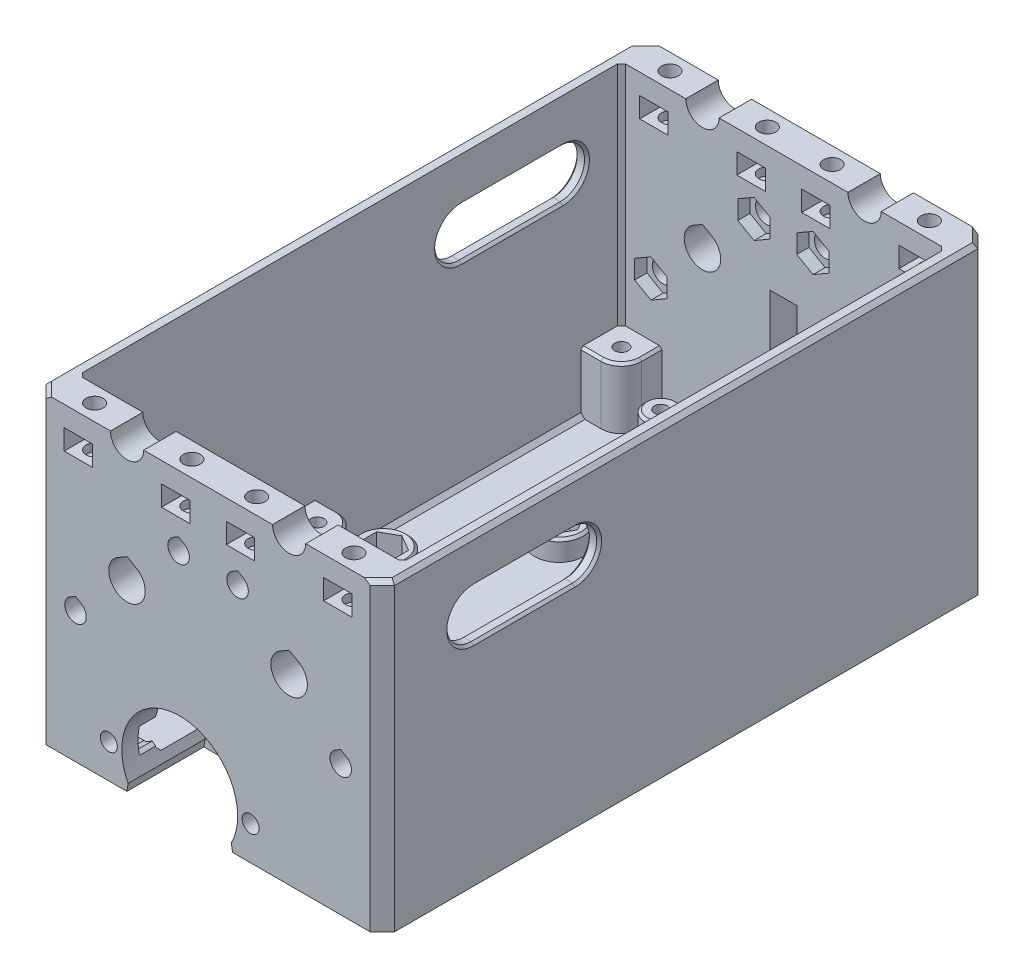
from build123d import *

# Parameters (mm, degrees)
SKETCH1_R                = 4.5
BOSS_EXTRUDE1_DEPTH      = 75
CUT_EXTRUDE1_START       = -4
SKETCH3_W                = 80
SKETCH3_H                = 134
CUT_EXTRUDE1_DEPTH       = 111.450862819
CUT_EXTRUDE2_DEPTH       = 106.233074649
CUT_EXTRUDE2_DEPTH_BACK  = 106.233074649
SKETCH4_R                = 2.65
SKETCH5_R                = 2.1
CUT_EXTRUDE3_DEPTH       = 12
CHAMFER1_SIZE            = 3
CUT_EXTRUDE5_START       = -5
SKETCH7_W                = 7
SKETCH7_H                = 20
CUT_EXTRUDE5_DEPTH       = 5
CUT_EXTRUDE6_DEPTH       = 3
CUT_EXTRUDE7_DEPTH       = 168.179544203
SKETCH11_R               = 2.6
CUT_EXTRUDE9_DEPTH       = 112.870460802
SKETCH14_W               = 3
SKETCH14_H               = 8
CUT_EXTRUDE12_DEPTH      = 112.870460802
FILLET1_R                = 1
CHAMFER2_SIZE            = 1
SKETCH15_R               = 1.6
CUT_EXTRUDE13_DEPTH      = 112.870460802
CUT_EXTRUDE14_DEPTH      = 129.922457314
CUT_EXTRUDE14_DEPTH_BACK = 10
CUT_EXTRUDE15_DEPTH      = 10
CHAMFER3_SIZE            = 1
CHAMFER4_SIZE            = 0.6
BOSS_EXTRUDE2_START      = 8
SKETCH18_R               = 4
SKETCH18_R_2             = 1.6
BOSS_EXTRUDE2_DEPTH      = 8
CHAMFER5_SIZE            = 0.6
SKETCH19_R               = 2.1
CUT_EXTRUDE16_DEPTH      = 19
CUT_EXTRUDE17_DEPTH      = 10
CUT_EXTRUDE17_DEPTH_BACK = 4
CHAMFER6_SIZE            = 0.770830909
CUT_EXTRUDE18_DEPTH      = 3.2
SKETCH22_R               = 6
BOSS_EXTRUDE3_DEPTH      = 5
CHAMFER7_SIZE            = 0.6
CHAMFER8_SIZE            = 1.432680857
CUT_EXTRUDE19_DEPTH      = 127.940931145
SKETCH25_W               = 6.6
SKETCH25_H               = 21
CUT_EXTRUDE20_DEPTH      = 10
SKETCH26_W               = 5
SKETCH26_H               = 21
SKETCH26_R               = 1.15
BOSS_EXTRUDE4_DEPTH      = 3
CHAMFER9_SIZE            = 4
SKETCH27_R               = 1.6
CUT_EXTRUDE21_DEPTH      = 116.282262296
BOSS_EXTRUDE5_START      = 5
SKETCH28_R               = 3.1
SKETCH28_R_2             = 1.6
BOSS_EXTRUDE5_DEPTH      = 5
CHAMFER10_SIZE           = 1.2
CHAMFER11_SIZE           = 0.6
CHAMFER12_SIZE           = 1.2
CUT_EXTRUDE22_DEPTH      = 116.77668159
BOSS_EXTRUDE6_DEPTH      = 3
CHAMFER13_SIZE           = 1.2
SKETCH31_R               = 1.65
CUT_EXTRUDE23_DEPTH      = 109.853112036
BOSS_EXTRUDE7_START      = 15
SKETCH32_R               = 5
SKETCH32_R_2             = 1.65
BOSS_EXTRUDE7_DEPTH      = 15
CUT_EXTRUDE24_START      = -6
CUT_EXTRUDE24_DEPTH      = 101.700515463
CHAMFER14_SIZE           = 0.6
SKETCH34_R               = 3
CUT_EXTRUDE26_DEPTH      = 15
SKETCH35_W               = 4
SKETCH35_H               = 6
CUT_EXTRUDE27_DEPTH      = 9
SKETCH36_W               = 3
SKETCH36_H               = 7
CUT_EXTRUDE28_DEPTH      = 116.282262296
FILLET2_R                = 1
CHAMFER15_SIZE           = 2


with BuildPart() as part:
    # Sketch1 → Boss-Extrude1 (new, symmetric)
    with BuildSketch(Plane.XY):
        with BuildLine():
            Line((-15.9, 15), (15.9, 15))
            ThreePointArc((15.9, 15), (20, 10.9), (24.1, 15))
            Line((24.1, 15), (43, 15))
            Line((43, 15), (43, -60))
            Line((43, -60), (-43, -60))
            Line((-43, -60), (-43, 15))
            Line((-43, 15), (-24.1, 15))
            ThreePointArc((-24.1, 15), (-20, 10.9), (-15.9, 15))
        make_face()
        with Locations((-20, -15)):
            Circle(SKETCH1_R, mode=Mode.SUBTRACT)
        with Locations((20, -15)):
            Circle(SKETCH1_R, mode=Mode.SUBTRACT)
    extrude(amount=BOSS_EXTRUDE1_DEPTH, both=True)

    # Sketch3 → Cut-Extrude1 (cut, through all)
    with BuildSketch(Plane.XZ.offset(60).offset(CUT_EXTRUDE1_START)):
        Rectangle(SKETCH3_W, SKETCH3_H)
    extrude(amount=-CUT_EXTRUDE1_DEPTH, mode=Mode.SUBTRACT)

    # Sketch4 → Cut-Extrude2 (cut, two sides: drawn at the far end of the back side and taken through both)
    with BuildSketch(Plane.XY.offset(-CUT_EXTRUDE2_DEPTH_BACK)):
        with Locations((-7.272077939, -2.272077939)):
            Circle(SKETCH4_R)
        with Locations((7.272077939, -2.272077939)):
            Circle(SKETCH4_R)
        with Locations((32.727922061, -27.727922061)):
            Circle(SKETCH4_R)
        with Locations((-32.727922061, -27.727922061)):
            Circle(SKETCH4_R)
    extrude(amount=CUT_EXTRUDE2_DEPTH + CUT_EXTRUDE2_DEPTH_BACK, mode=Mode.SUBTRACT)

    # Sketch5 → Cut-Extrude3 (cut)
    with BuildSketch(Plane(origin=(0, 15, 0), x_dir=(1, 0, 0), z_dir=(0, 1, 0))):
        with Locations(Location((-32, 71, 0), (0, 0, 180))):
            Circle(SKETCH5_R)
        with Locations(Location((-8, 71, 0), (0, 0, 180))):
            Circle(SKETCH5_R)
        with Locations(Location((8, 71, 0), (0, 0, 180))):
            Circle(SKETCH5_R)
        with Locations(Location((32, 71, 0), (0, 0, 180))):
            Circle(SKETCH5_R)
        with Locations(Location((-32, -71, 0), (0, 0, 180))):
            Circle(SKETCH5_R)
        with Locations(Location((-8, -71, 0), (0, 0, 180))):
            Circle(SKETCH5_R)
        with Locations(Location((8, -71, 0), (0, 0, 180))):
            Circle(SKETCH5_R)
        with Locations(Location((32, -71, 0), (0, 0, 180))):
            Circle(SKETCH5_R)
    extrude(amount=-CUT_EXTRUDE3_DEPTH, mode=Mode.SUBTRACT)

    # Chamfer1
    chamfer1_edges = [part.edges().sort_by_distance(p)[0] for p in [
        (-43, -22.5, -75),
        (-43, -22.5, 75),
        (43, -22.5, 75),
        (43, -22.5, -75),
    ]]
    chamfer(chamfer1_edges, length=CHAMFER1_SIZE)

    # Sketch7 → Cut-Extrude5 (cut)
    with BuildSketch(Plane(origin=(0, 15, 0), x_dir=(1, 0, 0), z_dir=(0, 1, 0)).offset(CUT_EXTRUDE5_START)):
        with Locations((-32, 71)):
            Rectangle(SKETCH7_W, SKETCH7_H)
        with Locations((-8, 71)):
            Rectangle(SKETCH7_W, SKETCH7_H)
        with Locations((8, 71)):
            Rectangle(SKETCH7_W, SKETCH7_H)
        with Locations((32, 71)):
            Rectangle(SKETCH7_W, SKETCH7_H)
        with Locations((-32, -71)):
            Rectangle(SKETCH7_W, SKETCH7_H)
        with Locations((-8, -71)):
            Rectangle(SKETCH7_W, SKETCH7_H)
        with Locations((8, -71)):
            Rectangle(SKETCH7_W, SKETCH7_H)
        with Locations((32, -71)):
            Rectangle(SKETCH7_W, SKETCH7_H)
    extrude(amount=-CUT_EXTRUDE5_DEPTH, mode=Mode.SUBTRACT)

    # Sketch8 → Cut-Extrude6 (cut)
    with BuildSketch(Plane(origin=(0, 0, 67), x_dir=(-1, 0, 0), z_dir=(0, 0, -1))):
        Polygon((-7.272077939, 2.346724215), (-11.272077939, 0.037323138), (-11.272077939, -4.581479015), (-7.272077939, -6.890880092), (-3.272077939, -4.581479015), (-3.272077939, 0.037323138), align=None)
        Polygon((7.272077939, 2.346724215), (3.272077939, 0.037323138), (3.272077939, -4.581479015), (7.272077939, -6.890880092), (11.272077939, -4.581479015), (11.272077939, 0.037323138), align=None)
        Polygon((-32.727922061, -23.109119908), (-36.727922061, -25.418520985), (-36.727922061, -30.037323138), (-32.727922061, -32.346724215), (-28.727922061, -30.037323138), (-28.727922061, -25.418520985), align=None)
        Polygon((32.727922061, -23.109119908), (28.727922061, -25.418520985), (28.727922061, -30.037323138), (32.727922061, -32.346724215), (36.727922061, -30.037323138), (36.727922061, -25.418520985), align=None)
    cut_extrude6 = extrude(amount=-CUT_EXTRUDE6_DEPTH, mode=Mode.SUBTRACT)

    # Mirror1: Cut-Extrude6 across plane
    add(cut_extrude6.mirror(Plane.XY), mode=Mode.SUBTRACT)

    # Sketch9 → Cut-Extrude7 (cut, through all)
    with BuildSketch(Plane.XY.offset(75)):
        Polygon((-22.25, -11.102885683), (-20, -9.803847577), (-17.75, -11.102885683), align=None)
        Polygon((-8.597077939, 0.022889381), (-7.272077939, 0.787878488), (-5.947077939, 0.022889381), align=None)
        Polygon((-34.052922061, -25.432954741), (-32.727922061, -24.667965635), (-31.402922061, -25.432954741), align=None)
        Polygon((5.947077939, 0.022889381), (7.272077939, 0.787878488), (8.597077939, 0.022889381), align=None)
        Polygon((22.25, -11.102885683), (20, -9.803847577), (17.75, -11.102885683), align=None)
        Polygon((31.402922061, -25.432954741), (32.727922061, -24.667965635), (34.052922061, -25.432954741), align=None)
    extrude(amount=-CUT_EXTRUDE7_DEPTH, mode=Mode.SUBTRACT)

    # Sketch11 → Cut-Extrude9 (cut, through all)
    with BuildSketch(Plane(origin=(0, -56, 0), x_dir=(1, 0, 0), z_dir=(0, 1, 0))):
        with Locations(Location((15.877132403, 27.5, 0), (0, 0, 270))):
            Circle(SKETCH11_R)
        with Locations(Location((31.754264805, 0, 0), (0, 0, 270))):
            Circle(SKETCH11_R)
        with Locations(Location((15.877132403, -27.5, 0), (0, 0, 270))):
            Circle(SKETCH11_R)
        with Locations(Location((-15.877132403, -27.5, 0), (0, 0, 270))):
            Circle(SKETCH11_R)
        with Locations(Location((-31.754264805, 0, 0), (0, 0, 270))):
            Circle(SKETCH11_R)
        with Locations(Location((-15.877132403, 27.5, 0), (0, 0, 270))):
            Circle(SKETCH11_R)
    extrude(amount=-CUT_EXTRUDE9_DEPTH, mode=Mode.SUBTRACT)

    # Sketch14 → Cut-Extrude12 (cut, through all)
    with BuildSketch(Plane(origin=(0, -56, 0), x_dir=(1, 0, 0), z_dir=(0, 1, 0))):
        with Locations((14, 0)):
            Rectangle(SKETCH14_W, SKETCH14_H)
        with Locations((20, 0)):
            Rectangle(SKETCH14_W, SKETCH14_H)
    extrude(amount=-CUT_EXTRUDE12_DEPTH, mode=Mode.SUBTRACT)

    # Fillet1
    fillet1_edges = [part.edges().sort_by_distance(p)[0] for p in [
        (12.5, -58, 4),
        (12.5, -58, -4),
        (15.5, -58, -4),
        (15.5, -58, 4),
        (18.5, -58, 4),
        (18.5, -58, -4),
        (21.5, -58, -4),
        (21.5, -58, 4),
    ]]
    fillet(fillet1_edges, radius=FILLET1_R)

    # Chamfer2
    chamfer2_edges = [part.edges().sort_by_distance(p)[0] for p in [
        (-40, -20.5, 67),
        (40, -20.5, -67),
        (-40, -20.5, -67),
        (40, -20.5, 67),
        (-40, -56, 0),
        (0, -56, -67),
        (40, -56, 0),
        (0, -56, 67),
    ]]
    chamfer(chamfer2_edges, length=CHAMFER2_SIZE)

    # Sketch15 → Cut-Extrude13 (cut, through all)
    with BuildSketch(Plane(origin=(0, -56, 0), x_dir=(1, 0, 0), z_dir=(0, 1, 0))):
        with Locations(Location((-23.75, 60.5, 0), (0, 0, 270))):
            Circle(SKETCH15_R)
        with Locations(Location((-8.25, 60.5, 0), (0, 0, 270))):
            Circle(SKETCH15_R)
        with Locations(Location((-23.75, -24.5, 0), (0, 0, 270))):
            Circle(SKETCH15_R)
        with Locations(Location((-8.25, -24.5, 0), (0, 0, 270))):
            Circle(SKETCH15_R)
    extrude(amount=-CUT_EXTRUDE13_DEPTH, mode=Mode.SUBTRACT)

    # Sketch16 → Cut-Extrude14 (cut, two sides: drawn at the far end of the back side and taken through both)
    with BuildSketch(Plane(origin=(43, 0, 0), x_dir=(0, 0, -1), z_dir=(1, 0, 0)).offset(-CUT_EXTRUDE14_DEPTH_BACK)):
        with BuildLine():
            Line((-52.5, 4), (-27.5, 4))
            ThreePointArc((-27.5, 4), (-21.5, -2), (-27.5, -8))
            Line((-27.5, -8), (-52.5, -8))
            ThreePointArc((-52.5, -8), (-58.5, -2), (-52.5, 4))
        make_face()
    extrude(amount=CUT_EXTRUDE14_DEPTH + CUT_EXTRUDE14_DEPTH_BACK, mode=Mode.SUBTRACT)

    # Sketch17 → Cut-Extrude15 (cut)
    with BuildSketch(Plane.ZY.offset(43)):
        with BuildLine():
            Line((-52.5, -8), (-27.5, -8))
            ThreePointArc((-27.5, -8), (-21.5, -2), (-27.5, 4))
            Line((-27.5, 4), (-52.5, 4))
            ThreePointArc((-52.5, 4), (-58.5, -2), (-52.5, -8))
        make_face()
    extrude(amount=-CUT_EXTRUDE15_DEPTH, mode=Mode.SUBTRACT)

    # Chamfer3
    chamfer3_edges = [part.edges().sort_by_distance(p)[0] for p in [
        (43, 15, 0),
        (41.5, 15, 73.5),
        (41.5, 15, -73.5),
        (-43, 15, 0),
        (-41.5, 15, 73.5),
        (-41.5, 15, -73.5),
    ]]
    chamfer(chamfer3_edges, length=CHAMFER3_SIZE)

    # Chamfer4
    chamfer4_edges = [part.edges().sort_by_distance(p)[0] for p in [
        (40, -8, 40),
        (40, -2, 21.5),
        (40, 4, 40),
        (40, -2, 58.5),
        (43, -2, 58.5),
        (43, -8, 40),
        (43, -2, 21.5),
        (43, 4, 40),
        (-40, -8, -40),
        (-40, -2, -21.5),
        (-40, 4, -40),
        (-40, -2, -58.5),
        (-43, -2, -58.5),
        (-43, -8, -40),
        (-43, -2, -21.5),
        (-43, 4, -40),
    ]]
    chamfer(chamfer4_edges, length=CHAMFER4_SIZE)

    # Sketch18 → Boss-Extrude2 (add)
    # profile 1 of 4: a face of its own
    with BuildSketch(Plane(origin=(0, -56, 0), x_dir=(1, 0, 0), z_dir=(0, 1, 0)).offset(BOSS_EXTRUDE2_START)):
        with Locations(Location((-23.75, 60.5, 0), (0, 0, 90))):
            Circle(SKETCH18_R)
        with Locations(Location((-23.75, 60.5, 0), (0, 0, 270))):
            Circle(SKETCH18_R_2, mode=Mode.SUBTRACT)
    # profile 2 of 4: a face of its own
    with BuildSketch(Plane(origin=(0, -56, 0), x_dir=(1, 0, 0), z_dir=(0, 1, 0)).offset(BOSS_EXTRUDE2_START)):
        with Locations(Location((-8.25, 60.5, 0), (0, 0, 90))):
            Circle(SKETCH18_R)
        with Locations(Location((-8.25, 60.5, 0), (0, 0, 270))):
            Circle(SKETCH18_R_2, mode=Mode.SUBTRACT)
    # profile 3 of 4: a face of its own
    with BuildSketch(Plane(origin=(0, -56, 0), x_dir=(1, 0, 0), z_dir=(0, 1, 0)).offset(BOSS_EXTRUDE2_START)):
        with Locations(Location((-8.25, -24.5, 0), (0, 0, 90))):
            Circle(SKETCH18_R)
        with Locations(Location((-8.25, -24.5, 0), (0, 0, 270))):
            Circle(SKETCH18_R_2, mode=Mode.SUBTRACT)
    # profile 4 of 4: a face of its own
    with BuildSketch(Plane(origin=(0, -56, 0), x_dir=(1, 0, 0), z_dir=(0, 1, 0)).offset(BOSS_EXTRUDE2_START)):
        with Locations(Location((-23.75, -24.5, 0), (0, 0, 90))):
            Circle(SKETCH18_R)
        with Locations(Location((-23.75, -24.5, 0), (0, 0, 270))):
            Circle(SKETCH18_R_2, mode=Mode.SUBTRACT)
    extrude(amount=-BOSS_EXTRUDE2_DEPTH)

    # Chamfer5
    chamfer5_edges = [part.edges().sort_by_distance(p)[0] for p in [
        (-23.75, -48, -56.5),
        (-8.25, -48, -56.5),
        (-8.25, -48, 28.5),
        (-23.75, -48, 28.5),
    ]]
    chamfer(chamfer5_edges, length=CHAMFER5_SIZE)

    # Sketch19 → Cut-Extrude16 (cut)
    with BuildSketch(Plane.XY.offset(75)):
        with Locations((-24.5, -51.637011669)):
            Circle(SKETCH19_R)
        with Locations((10.5, -51.637011669)):
            Circle(SKETCH19_R)
        with BuildLine():
            Line((2.5, -66.637011669), (-16.5, -66.637011669))
            Line((-16.5, -66.637011669), (-16.5, -62.325323042))
            ThreePointArc((-16.5, -62.325323042), (-7, -37.337011669), (2.5, -62.325323042))
            Line((2.5, -62.325323042), (2.5, -66.637011669))
        make_face()
    extrude(amount=-CUT_EXTRUDE16_DEPTH, mode=Mode.SUBTRACT)

    # Sketch20 → Cut-Extrude17 (cut, two sides: drawn at the far end of the back side and taken through both)
    with BuildSketch(Plane(origin=(0, 0, 67), x_dir=(-1, 0, 0), z_dir=(0, 0, -1)).offset(-CUT_EXTRUDE17_DEPTH_BACK)):
        Polygon((-10.5, -47.595559785), (-14, -49.616285727), (-14, -53.657737611), (-10.5, -55.678463554), (-7, -53.657737611), (-7, -49.616285727), align=None)
        Polygon((24.5, -47.595559785), (21, -49.616285727), (21, -53.657737611), (24.5, -55.678463554), (28, -53.657737611), (28, -49.616285727), align=None)
    extrude(amount=CUT_EXTRUDE17_DEPTH + CUT_EXTRUDE17_DEPTH_BACK, mode=Mode.SUBTRACT)

    # Chamfer6
    # the kernel refuses this chamfer: 1, 0.770830909 mm, written as the material it takes off along each edge
    with BuildSketch(Plane(origin=(-21.144358706, -53.741083149, 64.32993642), x_dir=(0.18295287149161907, -0.9831216846418205, 0), z_dir=(0, 0, 1)), Plane(origin=(7.144358706, -49.532940189, 64.32993642), x_dir=(-0.1829528714916195, 0.9831216846418205, 0), z_dir=(0, 0, 1))) as chamfer6_piece_1:
        with BuildLine():
            Line((1.038385485, 0), (CHAMFER6_SIZE * 0.333119007866, -CHAMFER6_SIZE * 0.94288478952))
            Line((CHAMFER6_SIZE * 0.333119007866, -CHAMFER6_SIZE * 0.94288478952), (0, 0))
            ThreePointArc((0, 0), (0.533862651, -0.009420797), (1.038385485, 0))
        make_face()
    extrude(amount=6.67006358, mode=Mode.SUBTRACT)
    with BuildSketch(Plane(origin=(-21.144358706, -49.532940189, 64.32993642), x_dir=(0.18295287149161368, 0.9831216846418214, 0), z_dir=(0, 0, 1)), Plane(origin=(7.144358706, -53.741083149, 64.32993642), x_dir=(-0.18295287149161452, -0.9831216846418214, 0), z_dir=(0, 0, 1))) as chamfer6_piece_2:
        with BuildLine():
            Line((1.038385485, 0), (CHAMFER6_SIZE * 0.333119007866, CHAMFER6_SIZE * 0.94288478952))
            Line((CHAMFER6_SIZE * 0.333119007866, CHAMFER6_SIZE * 0.94288478952), (0, 0))
            ThreePointArc((0, 0), (0.533862651, 0.009420797), (1.038385485, 0))
        make_face()
    extrude(amount=6.67006358, mode=Mode.SUBTRACT)

    # Sketch21 → Cut-Extrude18 (cut)
    with BuildSketch(Plane.XZ.offset(60)):
        Polygon((-23.75, 27.675426481), (-26.5, 26.08771324), (-26.5, 22.91228676), (-23.75, 21.324573519), (-21, 22.91228676), (-21, 26.08771324), align=None)
        Polygon((-8.25, 27.675426481), (-11, 26.08771324), (-11, 22.91228676), (-8.25, 21.324573519), (-5.5, 22.91228676), (-5.5, 26.08771324), align=None)
        Polygon((-8.25, -57.324573519), (-11, -58.91228676), (-11, -62.08771324), (-8.25, -63.675426481), (-5.5, -62.08771324), (-5.5, -58.91228676), align=None)
        Polygon((-23.75, -57.324573519), (-26.5, -58.91228676), (-26.5, -62.08771324), (-23.75, -63.675426481), (-21, -62.08771324), (-21, -58.91228676), align=None)
    extrude(amount=-CUT_EXTRUDE18_DEPTH, mode=Mode.SUBTRACT)

    # Sketch22 → Boss-Extrude3 (add)
    # profile 1 of 6: a face of its own
    with BuildSketch(Plane(origin=(0, -56, 0), x_dir=(1, 0, 0), z_dir=(0, 1, 0))):
        with Locations(Location((-15.877132403, 27.5, 0), (0, 0, 90))):
            Circle(SKETCH22_R)
        Polygon((-13.596598839, 31.45), (-18.157665966, 31.45), (-20.438199529, 27.5), (-18.157665966, 23.55), (-13.596598839, 23.55), (-11.316065276, 27.5), align=None, mode=Mode.SUBTRACT)
    # profile 2 of 6: a face of its own
    with BuildSketch(Plane(origin=(0, -56, 0), x_dir=(1, 0, 0), z_dir=(0, 1, 0))):
        with Locations(Location((15.877132403, 27.5, 0), (0, 0, 90))):
            Circle(SKETCH22_R)
        Polygon((18.157665966, 31.45), (13.596598839, 31.45), (11.316065276, 27.5), (13.596598839, 23.55), (18.157665966, 23.55), (20.438199529, 27.5), align=None, mode=Mode.SUBTRACT)
    # profile 3 of 6: a face of its own
    with BuildSketch(Plane(origin=(0, -56, 0), x_dir=(1, 0, 0), z_dir=(0, 1, 0))):
        with Locations(Location((-31.754264805, 0, 0), (0, 0, 90))):
            Circle(SKETCH22_R)
        Polygon((-27.804264805, 2.280533563), (-31.754264805, 4.561067127), (-35.704264805, 2.280533563), (-35.704264805, -2.280533563), (-31.754264805, -4.561067127), (-27.804264805, -2.280533563), align=None, mode=Mode.SUBTRACT)
    # profile 4 of 6: a face of its own
    with BuildSketch(Plane(origin=(0, -56, 0), x_dir=(1, 0, 0), z_dir=(0, 1, 0))):
        with Locations(Location((31.754264805, 0, 0), (0, 0, 90))):
            Circle(SKETCH22_R)
        Polygon((31.754264805, 4.561067127), (27.804264805, 2.280533563), (27.804264805, -2.280533563), (31.754264805, -4.561067127), (35.704264805, -2.280533563), (35.704264805, 2.280533563), align=None, mode=Mode.SUBTRACT)
    # profile 5 of 6: a face of its own
    with BuildSketch(Plane(origin=(0, -56, 0), x_dir=(1, 0, 0), z_dir=(0, 1, 0))):
        with Locations(Location((15.877132403, -27.5, 0), (0, 0, 90))):
            Circle(SKETCH22_R)
        Polygon((18.157665966, -23.55), (13.596598839, -23.55), (11.316065276, -27.5), (13.596598839, -31.45), (18.157665966, -31.45), (20.438199529, -27.5), align=None, mode=Mode.SUBTRACT)
    # profile 6 of 6: a face of its own
    with BuildSketch(Plane(origin=(0, -56, 0), x_dir=(1, 0, 0), z_dir=(0, 1, 0))):
        with Locations((-15.877132403, -27.5)):
            Circle(SKETCH22_R)
        Polygon((-13.596598839, -23.55), (-18.157665966, -23.55), (-20.438199529, -27.5), (-18.157665966, -31.45), (-13.596598839, -31.45), (-11.316065276, -27.5), align=None, mode=Mode.SUBTRACT)
    extrude(amount=BOSS_EXTRUDE3_DEPTH)

    # Chamfer7
    chamfer7_edges = [part.edges().sort_by_distance(p)[0] for p in [
        (15.877132403, -51, -21.5),
        (-31.754264805, -51, 6),
        (31.754264805, -51, 6),
        (-15.877132403, -51, -21.5),
        (15.877132403, -51, 33.5),
        (-15.999674817, -51, 21.501251517),
        (-15.935624022, -51, 33.499714887),
    ]]
    chamfer(chamfer7_edges, length=CHAMFER7_SIZE)

    # Chamfer8
    # the kernel refuses this chamfer: 2, 1.432680857 mm, written as the material it takes off along each edge
    with BuildSketch(Plane(origin=(-18.599587328, -60, 56), x_dir=(-0.5215603469005727, 0.853214395413576, 0), z_dir=(0, 0, 1))) as chamfer8_piece_1:
        with BuildLine():
            Line((2.171074484, 0), (CHAMFER8_SIZE * 0.521560346851, CHAMFER8_SIZE * 0.853214395332))
            Line((CHAMFER8_SIZE * 0.521560346851, CHAMFER8_SIZE * 0.853214395332), (0, 0))
            ThreePointArc((0, 0), (1.116030486, 0.041229504), (2.171074484, 0))
        make_face()
    extrude(amount=24.580955797, mode=Mode.SUBTRACT)
    with BuildSketch(Plane(origin=(4.599587328, -60, 56), x_dir=(0.5215603469005704, 0.8532143954135775, 0), z_dir=(0, 0, 1))) as chamfer8_piece_2:
        with BuildLine():
            Line((2.171074484, 0), (CHAMFER8_SIZE * 0.521560346851, -CHAMFER8_SIZE * 0.853214395332))
            Line((CHAMFER8_SIZE * 0.521560346851, -CHAMFER8_SIZE * 0.853214395332), (0, 0))
            ThreePointArc((0, 0), (1.116030486, -0.041229504), (2.171074484, 0))
        make_face()
    extrude(amount=24.580955797, mode=Mode.SUBTRACT)

    # Sketch24 → Cut-Extrude19 (cut, through all)
    with BuildSketch(Plane(origin=(-40, 0, 0), x_dir=(0, 0, -1), z_dir=(1, 0, 0))):
        with BuildLine():
            Line((-47.103881908, -50.35), (-52.896118092, -50.35))
            ThreePointArc((-52.896118092, -50.35), (-57.9, -43), (-52.896118092, -35.65))
            Line((-52.896118092, -35.65), (-47.103881908, -35.65))
            ThreePointArc((-47.103881908, -35.65), (-42.1, -43), (-47.103881908, -50.35))
        make_face()
    extrude(amount=-CUT_EXTRUDE19_DEPTH, mode=Mode.SUBTRACT)

    # Sketch25 → Cut-Extrude20 (cut)
    with BuildSketch(Plane(origin=(0, 0, -75), x_dir=(-1, 0, 0), z_dir=(0, 0, -1))):
        with Locations((0, -30)):
            Rectangle(SKETCH25_W, SKETCH25_H)
    extrude(amount=-CUT_EXTRUDE20_DEPTH, mode=Mode.SUBTRACT)

    # Sketch26 → Boss-Extrude4 (add)
    with BuildSketch(Plane(origin=(-3.3, 0, 0), x_dir=(0, 0, -1), z_dir=(1, 0, 0))):
        with Locations((77.5, -30)):
            Rectangle(SKETCH26_W, SKETCH26_H)
        with Locations(Location((77.5, -25.25, 0), (0, 0, 90))):
            Circle(SKETCH26_R, mode=Mode.SUBTRACT)
        with Locations(Location((77.5, -34.75, 0), (0, 0, 90))):
            Circle(SKETCH26_R, mode=Mode.SUBTRACT)
    extrude(amount=-BOSS_EXTRUDE4_DEPTH)

    # Chamfer9
    chamfer9_edges = [part.edges().sort_by_distance(p)[0] for p in [
        (0, -19.5, -67),
    ]]
    chamfer(chamfer9_edges, length=CHAMFER9_SIZE)

    # Sketch27 → Cut-Extrude21 (cut, through all)
    with BuildSketch(Plane(origin=(0, -56, 0), x_dir=(1, 0, 0), z_dir=(0, 1, 0))):
        with Locations(Location((2.5, 62.5, 0), (0, 0, 270))):
            Circle(SKETCH27_R)
        with Locations(Location((33.5, 62.5, 0), (0, 0, 270))):
            Circle(SKETCH27_R)
        with Locations(Location((33.5, 37.5, 0), (0, 0, 270))):
            Circle(SKETCH27_R)
        with Locations(Location((2.5, 37.5, 0), (0, 0, 270))):
            Circle(SKETCH27_R)
    extrude(amount=-CUT_EXTRUDE21_DEPTH, mode=Mode.SUBTRACT)

    # Sketch28 → Boss-Extrude5 (add)
    # profile 1 of 4: a face of its own
    with BuildSketch(Plane(origin=(0, -56, 0), x_dir=(1, 0, 0), z_dir=(0, 1, 0)).offset(BOSS_EXTRUDE5_START)):
        with Locations(Location((2.5, 37.5, 0), (0, 0, 90))):
            Circle(SKETCH28_R)
        with Locations(Location((2.5, 37.5, 0), (0, 0, 270))):
            Circle(SKETCH28_R_2, mode=Mode.SUBTRACT)
    # profile 2 of 4: a face of its own
    with BuildSketch(Plane(origin=(0, -56, 0), x_dir=(1, 0, 0), z_dir=(0, 1, 0)).offset(BOSS_EXTRUDE5_START)):
        with Locations(Location((2.5, 62.5, 0), (0, 0, 90))):
            Circle(SKETCH28_R)
        with Locations(Location((2.5, 62.5, 0), (0, 0, 270))):
            Circle(SKETCH28_R_2, mode=Mode.SUBTRACT)
    # profile 3 of 4: a face of its own
    with BuildSketch(Plane(origin=(0, -56, 0), x_dir=(1, 0, 0), z_dir=(0, 1, 0)).offset(BOSS_EXTRUDE5_START)):
        with Locations(Location((33.5, 62.5, 0), (0, 0, 90))):
            Circle(SKETCH28_R)
        with Locations(Location((33.5, 62.5, 0), (0, 0, 270))):
            Circle(SKETCH28_R_2, mode=Mode.SUBTRACT)
    # profile 4 of 4: a face of its own
    with BuildSketch(Plane(origin=(0, -56, 0), x_dir=(1, 0, 0), z_dir=(0, 1, 0)).offset(BOSS_EXTRUDE5_START)):
        with Locations(Location((33.5, 37.5, 0), (0, 0, 90))):
            Circle(SKETCH28_R)
        with Locations(Location((33.5, 37.5, 0), (0, 0, 270))):
            Circle(SKETCH28_R_2, mode=Mode.SUBTRACT)
    extrude(amount=-BOSS_EXTRUDE5_DEPTH)

    # Chamfer10
    # the kernel refuses this chamfer: 1.2 mm, written as the material it adds along each edge
    with BuildSketch(Plane(origin=(2.5, -56, -37.5), x_dir=(0, 0, -1), z_dir=(1, 0, 0))) as chamfer10_piece_1:
        Polygon((3.1 + CHAMFER10_SIZE, 0), (3.1, CHAMFER10_SIZE), (3.1, 0), align=None)
    revolve(axis=Axis((2.5, -56, -37.5), (0, 1, 0)))
    with BuildSketch(Plane(origin=(2.5, -56, -62.5), x_dir=(0, 0, -1), z_dir=(1, 0, 0))) as chamfer10_piece_2:
        Polygon((3.1 + CHAMFER10_SIZE, 0), (3.1, CHAMFER10_SIZE), (3.1, 0), align=None)
    revolve(axis=Axis((2.5, -56, -62.5), (0, 1, 0)))
    with BuildSketch(Plane(origin=(33.5, -56, -62.5), x_dir=(0, 0, -1), z_dir=(1, 0, 0))) as chamfer10_piece_3:
        Polygon((3.1 + CHAMFER10_SIZE, 0), (3.1, CHAMFER10_SIZE), (3.1, 0), align=None)
    revolve(axis=Axis((33.5, -56, -62.5), (0, 1, 0)))
    with BuildSketch(Plane(origin=(33.5, -56, -37.5), x_dir=(0, 0, -1), z_dir=(1, 0, 0))) as chamfer10_piece_4:
        Polygon((3.1 + CHAMFER10_SIZE, 0), (3.1, CHAMFER10_SIZE), (3.1, 0), align=None)
    revolve(axis=Axis((33.5, -56, -37.5), (0, 1, 0)))

    # Chamfer11
    chamfer11_edges = [part.edges().sort_by_distance(p)[0] for p in [
        (2.5, -51, -34.4),
        (2.5, -51, -59.4),
        (33.5, -51, -59.4),
        (33.5, -51, -34.4),
    ]]
    chamfer(chamfer11_edges, length=CHAMFER11_SIZE)

    # Chamfer12
    chamfer12_edges = [part.edges().sort_by_distance(p)[0] for p in [
        (-23.75, -56, -56.5),
        (-8.25, -56, -56.5),
        (-27.628734698, -56, 25.477454419),
        (-4.341361926, -56, 25.350028472),
    ]]
    chamfer(chamfer12_edges, length=CHAMFER12_SIZE)

    # Sketch29 → Cut-Extrude22 (cut, through all)
    with BuildSketch(Plane.XZ.offset(56.8)):
        Polygon((2.5, -34.324573519), (-0.25, -35.91228676), (-0.25, -39.08771324), (2.5, -40.675426481), (5.25, -39.08771324), (5.25, -35.91228676), align=None)
        Polygon((33.5, -34.324573519), (30.75, -35.91228676), (30.75, -39.08771324), (33.5, -40.675426481), (36.25, -39.08771324), (36.25, -35.91228676), align=None)
        Polygon((33.5, -59.324573519), (30.75, -60.91228676), (30.75, -64.08771324), (33.5, -65.675426481), (36.25, -64.08771324), (36.25, -60.91228676), align=None)
        Polygon((2.5, -59.324573519), (-0.25, -60.91228676), (-0.25, -64.08771324), (2.5, -65.675426481), (5.25, -64.08771324), (5.25, -60.91228676), align=None)
    extrude(amount=CUT_EXTRUDE22_DEPTH, mode=Mode.SUBTRACT)

    # Sketch30 → Boss-Extrude6 (add)
    with BuildSketch(Plane(origin=(-3.3, 0, 0), x_dir=(0, 0, -1), z_dir=(1, 0, 0))):
        Polygon((80, -40.5), (75, -45.5), (75, -40.5), align=None)
    extrude(amount=-BOSS_EXTRUDE6_DEPTH)

    # Chamfer13
    chamfer13_edges = [part.edges().sort_by_distance(p)[0] for p in [
        (-4.8, -19.5, -80),
    ]]
    chamfer(chamfer13_edges, length=CHAMFER13_SIZE)

    # Sketch31 → Cut-Extrude23 (cut, through all)
    with BuildSketch(Plane(origin=(0, 0, 0), x_dir=(1, 0, 0), z_dir=(0, 1, 0))):
        with Locations(Location((-35, -13, 0), (0, 0, 270))):
            Circle(SKETCH31_R)
        with Locations(Location((-35, 62, 0), (0, 0, 270))):
            Circle(SKETCH31_R)
        with Locations(Location((0, -36, 0), (0, 0, 270))):
            Circle(SKETCH31_R)
        with Locations(Location((35, -62, 0), (0, 0, 270))):
            Circle(SKETCH31_R)
        with Locations(Location((35, -22, 0), (0, 0, 270))):
            Circle(SKETCH31_R)
        with Locations(Location((35, 22, 0), (0, 0, 270))):
            Circle(SKETCH31_R)
    extrude(amount=-CUT_EXTRUDE23_DEPTH, mode=Mode.SUBTRACT)

    # Sketch32 → Boss-Extrude7 (add)
    # profile 1 of 6: a face of its own
    with BuildSketch(Plane(origin=(0, -56, 0), x_dir=(1, 0, 0), z_dir=(0, 1, 0)).offset(BOSS_EXTRUDE7_START)):
        with Locations(Location((0, -36, 0), (0, 0, 90))):
            Circle(SKETCH32_R)
        with Locations(Location((0, -36, 0), (0, 0, 270))):
            Circle(SKETCH32_R_2, mode=Mode.SUBTRACT)
    # profile 2 of 6: a face of its own
    with BuildSketch(Plane(origin=(0, -56, 0), x_dir=(1, 0, 0), z_dir=(0, 1, 0)).offset(BOSS_EXTRUDE7_START)):
        with BuildLine():
            Line((-30, 62), (-30, 67))
            Line((-30, 67), (-40, 67))
            Line((-40, 67), (-40, 57))
            Line((-40, 57), (-35, 57))
            ThreePointArc((-35, 57), (-31.464466094, 58.464466094), (-30, 62))
        make_face()
        with Locations(Location((-35, 62, 0), (0, 0, 270))):
            Circle(SKETCH32_R_2, mode=Mode.SUBTRACT)
    # profile 3 of 6: a face of its own
    with BuildSketch(Plane(origin=(0, -56, 0), x_dir=(1, 0, 0), z_dir=(0, 1, 0)).offset(BOSS_EXTRUDE7_START)):
        with BuildLine():
            Line((-35, -8), (-40, -8))
            Line((-40, -8), (-40, -18))
            Line((-40, -18), (-35, -18))
            ThreePointArc((-35, -18), (-30, -13), (-35, -8))
        make_face()
        with Locations(Location((-35, -13, 0), (0, 0, 270))):
            Circle(SKETCH32_R_2, mode=Mode.SUBTRACT)
    # profile 4 of 6: a face of its own
    with BuildSketch(Plane(origin=(0, -56, 0), x_dir=(1, 0, 0), z_dir=(0, 1, 0)).offset(BOSS_EXTRUDE7_START)):
        with BuildLine():
            Line((35, -17), (40, -17))
            Line((40, -17), (40, -27))
            Line((40, -27), (35, -27))
            ThreePointArc((35, -27), (30, -22), (35, -17))
        make_face()
        with Locations(Location((35, -22, 0), (0, 0, 270))):
            Circle(SKETCH32_R_2, mode=Mode.SUBTRACT)
    # profile 5 of 6: a face of its own
    with BuildSketch(Plane(origin=(0, -56, 0), x_dir=(1, 0, 0), z_dir=(0, 1, 0)).offset(BOSS_EXTRUDE7_START)):
        with BuildLine():
            Line((35, 27), (40, 27))
            Line((40, 27), (40, 17))
            Line((40, 17), (35, 17))
            ThreePointArc((35, 17), (30, 22), (35, 27))
        make_face()
        with Locations(Location((35, 22, 0), (0, 0, 270))):
            Circle(SKETCH32_R_2, mode=Mode.SUBTRACT)
    # profile 6 of 6: a face of its own
    with BuildSketch(Plane(origin=(0, -56, 0), x_dir=(1, 0, 0), z_dir=(0, 1, 0)).offset(BOSS_EXTRUDE7_START)):
        with BuildLine():
            Line((30, -62), (30, -67))
            Line((30, -67), (40, -67))
            Line((40, -67), (40, -57))
            Line((40, -57), (35, -57))
            ThreePointArc((35, -57), (31.464466094, -58.464466094), (30, -62))
        make_face()
        with Locations(Location((35, -62, 0), (0, 0, 270))):
            Circle(SKETCH32_R_2, mode=Mode.SUBTRACT)
    extrude(amount=-BOSS_EXTRUDE7_DEPTH)

    # Sketch33 → Cut-Extrude24 (cut, through all)
    with BuildSketch(Plane(origin=(0, -41, 0), x_dir=(1, 0, 0), z_dir=(0, 1, 0)).offset(CUT_EXTRUDE24_START)):
        Polygon((-33.41228676, 64.75), (-36.58771324, 64.75), (-38.175426481, 62), (-36.58771324, 59.25), (-33.41228676, 59.25), (-31.824573519, 62), align=None)
        Polygon((36.58771324, 24.75), (33.41228676, 24.75), (31.824573519, 22), (33.41228676, 19.25), (36.58771324, 19.25), (38.175426481, 22), align=None)
        Polygon((36.58771324, -19.25), (33.41228676, -19.25), (31.824573519, -22), (33.41228676, -24.75), (36.58771324, -24.75), (38.175426481, -22), align=None)
        Polygon((36.58771324, -59.25), (33.41228676, -59.25), (31.824573519, -62), (33.41228676, -64.75), (36.58771324, -64.75), (38.175426481, -62), align=None)
        Polygon((-1.58771324, -33.25), (-3.175426481, -36), (-1.58771324, -38.75), (1.58771324, -38.75), (3.175426481, -36), (1.58771324, -33.25), align=None)
        Polygon((-33.41228676, -10.25), (-36.58771324, -10.25), (-38.175426481, -13), (-36.58771324, -15.75), (-33.41228676, -15.75), (-31.824573519, -13), align=None)
    extrude(amount=-CUT_EXTRUDE24_DEPTH, mode=Mode.SUBTRACT)

    # Chamfer14
    chamfer14_edges = [part.edges().sort_by_distance(p)[0] for p in [
        (-37.5, -41, -57),
        (-31.464466094, -41, -58.464466094),
        (-30, -41, -64.5),
        (30, -41, -22),
        (37.5, -41, -17),
        (37.5, -41, -27),
        (30, -41, 22),
        (37.5, -41, 27),
        (37.5, -41, 17),
        (-30, -41, 13),
        (-37.5, -41, 8),
        (-37.5, -41, 18),
        (0, -41, 41),
        (37.5, -41, 57),
        (31.464466094, -41, 58.464466094),
        (30, -41, 64.5),
    ]]
    chamfer(chamfer14_edges, length=CHAMFER14_SIZE)

    # Sketch34 → Cut-Extrude26 (cut)
    with BuildSketch(Plane.XY.offset(-67)):
        with Locations((-16, -50)):
            Circle(SKETCH34_R)
    extrude(amount=-CUT_EXTRUDE26_DEPTH, mode=Mode.SUBTRACT)

    # Sketch35 → Cut-Extrude27 (cut)
    with BuildSketch(Plane(origin=(0, 0, -75), x_dir=(-1, 0, 0), z_dir=(0, 0, -1))):
        with Locations((-4, -50)):
            Rectangle(SKETCH35_W, SKETCH35_H)
        with Locations((4, -50)):
            Rectangle(SKETCH35_W, SKETCH35_H)
    extrude(amount=-CUT_EXTRUDE27_DEPTH, mode=Mode.SUBTRACT)

    # Sketch36 → Cut-Extrude28 (cut, through all)
    with BuildSketch(Plane(origin=(0, -56, 0), x_dir=(1, 0, 0), z_dir=(0, 1, 0))):
        with Locations((-11, -49)):
            Rectangle(SKETCH36_W, SKETCH36_H)
        with Locations((-3, -49)):
            Rectangle(SKETCH36_W, SKETCH36_H)
    extrude(amount=-CUT_EXTRUDE28_DEPTH, mode=Mode.SUBTRACT)

    # Fillet2
    fillet2_edges = [part.edges().sort_by_distance(p)[0] for p in [
        (-12.5, -58, 52.5),
        (-12.5, -58, 45.5),
        (-9.5, -58, 45.5),
        (-9.5, -58, 52.5),
        (-4.5, -58, 52.5),
        (-4.5, -58, 45.5),
        (-1.5, -58, 45.5),
        (-1.5, -58, 52.5),
    ]]
    fillet(fillet2_edges, radius=FILLET2_R)

    # Chamfer15
    chamfer15_edges = [part.edges().sort_by_distance(p)[0] for p in [
        (-7, -56, 56),
    ]]
    chamfer(chamfer15_edges, length=CHAMFER15_SIZE)


solid = part.part
